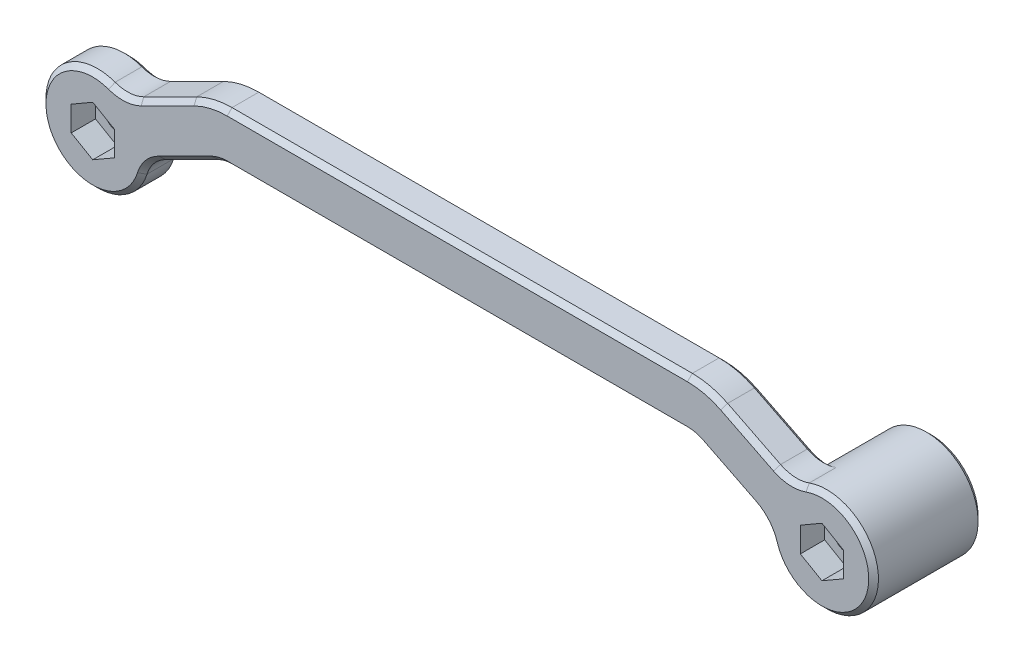
from build123d import *

# Parameters (mm, degrees)
SKETCH1_R                = 2.05
BOSS_EXTRUDE1_DEPTH      = 6
CUT_EXTRUDE1_DEPTH       = 4
BOSS_EXTRUDE2_DEPTH      = 12
BOSS_EXTRUDE2_DEPTH_BACK = 1
SKETCH4_R                = 8.5
SKETCH4_R_2              = 2.05
CHAMFER3_SIZE            = 0.8


with BuildPart() as part:
    # Sketch1 → Boss-Extrude1 (new body)
    with BuildSketch(Plane.XY):
        with BuildLine():
            Line((-52.397368877, 8.273451517), (-43.689164944, 12.627553483))
            ThreePointArc((-43.689164944, 12.627553483), (-40.86217617, 13.652236863), (-37.875388203, 14))
            Line((-37.875388203, 14), (37.875388203, 14))
            ThreePointArc((37.875388203, 14), (40.86217617, 13.652236863), (43.689164944, 12.627553483))
            Line((43.689164944, 12.627553483), (52.397368877, 8.273451517))
            ThreePointArc((52.397368877, 8.273451517), (54.728318318, 7.650368424), (57.116243367, 7.995870664))
            ThreePointArc((57.116243367, 7.995870664), (67.602631123, -3.801315562), (51.873049489, -2.490517092))
            ThreePointArc((51.873049489, -2.490517092), (50.716696252, -0.372875708), (48.819660113, 1.118033989))
            Line((48.819660113, 1.118033989), (40.11145618, 5.472135955))
            ThreePointArc((40.11145618, 5.472135955), (39.024152805, 5.866244947), (37.875388203, 6))
            Line((37.875388203, 6), (-37.875388203, 6))
            ThreePointArc((-37.875388203, 6), (-39.024152805, 5.866244947), (-40.11145618, 5.472135955))
            Line((-40.11145618, 5.472135955), (-48.819660113, 1.118033989))
            ThreePointArc((-48.819660113, 1.118033989), (-50.716696252, -0.372875708), (-51.873049489, -2.490517092))
            ThreePointArc((-51.873049489, -2.490517092), (-67.602631123, -3.801315562), (-57.116243367, 7.995870664))
            ThreePointArc((-57.116243367, 7.995870664), (-54.728318318, 7.650368424), (-52.397368877, 8.273451517))
        make_face()
        with Locations((-60, 0)):
            Circle(SKETCH1_R, mode=Mode.SUBTRACT)
        with Locations((60, 0)):
            Circle(SKETCH1_R, mode=Mode.SUBTRACT)
    extrude(amount=BOSS_EXTRUDE1_DEPTH)

    # Sketch3 → Cut-Extrude1 (cut)
    with BuildSketch(Plane.XY.offset(6)):
        Polygon((-60, 4.099186911), (-63.55, 2.049593456), (-63.55, -2.049593456), (-60, -4.099186911), (-56.45, -2.049593456), (-56.45, 2.049593456), align=None)
        Polygon((60, 4.099186911), (56.45, 2.049593456), (56.45, -2.049593456), (60, -4.099186911), (63.55, -2.049593456), (63.55, 2.049593456), align=None)
    extrude(amount=-CUT_EXTRUDE1_DEPTH, mode=Mode.SUBTRACT)

    # Sketch4 → Boss-Extrude2 (add, two sides: drawn at the far end of the back side and taken through both)
    with BuildSketch(Plane(origin=(0, 0, 0), x_dir=(-1, 0, 0), z_dir=(0, 0, -1)).offset(-BOSS_EXTRUDE2_DEPTH_BACK)):
        with Locations((-60, 0)):
            Circle(SKETCH4_R)
        with Locations((-60, 0)):
            Circle(SKETCH4_R_2, mode=Mode.SUBTRACT)
    extrude(amount=BOSS_EXTRUDE2_DEPTH + BOSS_EXTRUDE2_DEPTH_BACK)

    # Chamfer3
    # the kernel refuses this chamfer: 0.8 mm, written as the material it adds along each edge
    # the kernel refuses this chamfer: 0.8 mm, written as the material it takes off along each edge
    with BuildSketch(Plane(origin=(37.875388203, 1, 0), x_dir=(0.44721359549995965, 0.894427190999915, 0), z_dir=(0.894427190999915, -0.44721359549995965, 0))) as chamfer3_2_piece_1:
        Polygon((5, CHAMFER3_SIZE), (5 + CHAMFER3_SIZE, 0), (5, 0), align=None)
    revolve(axis=Axis((37.875388203, 1, 0), (0, 0, 1)), revolution_arc=26.565051177, mode=Mode.SUBTRACT)
    with BuildSketch(Plane(origin=(48.819660113, 1.118033989, 0), x_dir=(-0.012296529840444168, -0.024593059680888388, 0.9996219169112966), z_dir=(-0.8944271909999163, 0.44721359549995715, 0)), Plane(origin=(-40.11145618, 5.472135955, 0), x_dir=(0.01229652984044405, -0.02459305968088818, 0.9996219169112966), z_dir=(-0.8944271909999165, -0.4472135954999568, 0)), Plane(origin=(43.689164944, 12.627553483, 0), x_dir=(0.012296529840444093, 0.02459305968088816, 0.9996219169112966), z_dir=(0.8944271909999156, -0.44721359549995837, 0)), Plane(origin=(48.819660113, 1.118033989, 6), x_dir=(0.4470445116024604, 0.8940890232049228, 0.02749587661058619), z_dir=(-0.8944271909999163, 0.44721359549995715, 0)), Plane(origin=(-40.11145618, 5.472135955, 6), x_dir=(-0.4470445116024601, 0.8940890232049231, 0.02749587661058619), z_dir=(-0.8944271909999165, -0.4472135954999568, 0)), Plane(origin=(43.689164944, 12.627553483, 6), x_dir=(-0.4470445116024617, -0.8940890232049222, 0.027495876610586216), z_dir=(0.8944271909999156, -0.44721359549995837, 0)), Plane(origin=(-52.397368877, 8.273451517, 6), x_dir=(0.44704451160246106, -0.8940890232049225, 0.027495876610586212), z_dir=(0.894427190999916, 0.4472135954999578, 0))) as chamfer3_2_piece_2:
        Polygon((CHAMFER3_SIZE * 0.999621916911, CHAMFER3_SIZE * 0.0274958766106), (-CHAMFER3_SIZE * 0.0274958766106, CHAMFER3_SIZE * 0.999621916911), (0, 0), align=None)
    extrude(amount=9.736067977, mode=Mode.SUBTRACT)
    with BuildSketch(Plane(origin=(37.875388203, 6, 0), x_dir=(0, -0.027495876610586275, 0.9996219169112968), z_dir=(-1, 0, 0)), Plane(origin=(-37.875388203, 14, 0), x_dir=(0, 0.02749587661058735, 0.9996219169112966), z_dir=(1, 0, 0)), Plane(origin=(37.875388203, 6, 6), x_dir=(0, 0.9996219169112968, 0.027495876610586285), z_dir=(-1, 0, 0)), Plane(origin=(-37.875388203, 14, 6), x_dir=(0, -0.9996219169112968, 0.027495876610586226), z_dir=(1, 0, 0))) as chamfer3_2_piece_3:
        Polygon((CHAMFER3_SIZE * 0.999621916911, CHAMFER3_SIZE * 0.0274958766106), (-CHAMFER3_SIZE * 0.0274958766106, CHAMFER3_SIZE * 0.999621916911), (0, 0), align=None)
    extrude(amount=75.750776405, mode=Mode.SUBTRACT)
    with BuildSketch(Plane(origin=(46.13637854, -4.248529157, 0), x_dir=(0.9989622079668251, -0.04554675678954209, 0), z_dir=(-0.04554675678954209, -0.9989622079668251, 0))) as chamfer3_2_piece_4_section:
        Polygon((6, CHAMFER3_SIZE), (6 + CHAMFER3_SIZE, 0), (6, 0), align=None)
    chamfer3_2_piece_4 = revolve(axis=Axis((46.13637854, -4.248529157, 0), (0, 0, 1)), revolution_arc=66.045488886, mode=Mode.PRIVATE)
    chamfer3_2_piece_4 = chamfer3_2_piece_4 - Plane(origin=(60, 0, 0.316419024), x_dir=(-1, 0, 0), z_dir=(0, 0, 1)) * Cylinder(8.5, 28, mode=Mode.PRIVATE)
    add(chamfer3_2_piece_4, mode=Mode.SUBTRACT)
    with BuildSketch(Plane(origin=(-37.875388203, 1, 0), x_dir=(0, 1, 0), z_dir=(1, 0, 0))) as chamfer3_2_piece_5:
        Polygon((5, CHAMFER3_SIZE), (5 + CHAMFER3_SIZE, 0), (5, 0), align=None)
    revolve(axis=Axis((-37.875388203, 1, 0), (0, 0, 1)), revolution_arc=26.565051177, mode=Mode.SUBTRACT)
    with BuildSketch(Plane(origin=(55.08065045, 13.640014663, 0), x_dir=(-0.44721359549995726, -0.8944271909999163, 0), z_dir=(-0.8944271909999163, 0.44721359549995726, 0))) as chamfer3_2_piece_6_section:
        Polygon((6, CHAMFER3_SIZE), (6 + CHAMFER3_SIZE, 0), (6, 0), align=None)
    chamfer3_2_piece_6 = revolve(axis=Axis((55.08065045, 13.640014663, 0), (0, 0, 1)), revolution_arc=66.045488886, mode=Mode.PRIVATE)
    chamfer3_2_piece_6 = chamfer3_2_piece_6 - Plane(origin=(60, 0, 0.316418933), x_dir=(-1, 0, 0), z_dir=(0, 0, 1)) * Cylinder(8.5, 28, mode=Mode.PRIVATE)
    add(chamfer3_2_piece_6, mode=Mode.SUBTRACT)
    with BuildSketch(Plane(origin=(-46.13637854, -4.248529157, 0), x_dir=(-0.4472135954999641, 0.8944271909999129, 0), z_dir=(0.8944271909999129, 0.4472135954999641, 0))) as chamfer3_2_piece_7:
        Polygon((6, CHAMFER3_SIZE), (6 + CHAMFER3_SIZE, 0), (6, 0), align=None)
    revolve(axis=Axis((-46.13637854, -4.248529157, 0), (0, 0, 1)), revolution_arc=46.397181027, mode=Mode.SUBTRACT)
    with BuildSketch(Plane(origin=(-60, 0, 0), x_dir=(0.9561118248619797, -0.29300201084479827, 0), z_dir=(0.29300201084479827, 0.9561118248619797, 0))) as chamfer3_2_piece_8:
        Polygon((8.5 - CHAMFER3_SIZE, 0), (8.5, -CHAMFER3_SIZE), (8.5, 0), align=None)
    revolve(axis=Axis((-60, 0, 0), (0, 0, -1)), revolution_arc=272.794362055, mode=Mode.SUBTRACT)
    with BuildSketch(Plane(origin=(37.875388203, 1, 0), x_dir=(0, 1, 0), z_dir=(-1, 0, 0))) as chamfer3_2_piece_9:
        Polygon((13, -CHAMFER3_SIZE), (13 - CHAMFER3_SIZE, 0), (13, 0), align=None)
    revolve(axis=Axis((37.875388203, 1, 0), (0, 0, -1)), revolution_arc=26.565051177, mode=Mode.SUBTRACT)
    with BuildSketch(Plane(origin=(-55.08065045, 13.640014663, 0), x_dir=(-0.3392654862413453, -0.940690666396464, 0), z_dir=(-0.940690666396464, 0.3392654862413453, 0))) as chamfer3_2_piece_10:
        Polygon((6, CHAMFER3_SIZE), (6 + CHAMFER3_SIZE, 0), (6, 0), align=None)
    revolve(axis=Axis((-55.08065045, 13.640014663, 0), (0, 0, 1)), revolution_arc=46.397181027, mode=Mode.SUBTRACT)
    with BuildSketch(Plane(origin=(-52.397368877, 8.273451517, 0), x_dir=(0.44704451160246106, -0.8940890232049225, -0.027495876610586303), z_dir=(0.894427190999916, 0.4472135954999578, 0))) as chamfer3_2_piece_11:
        Polygon((CHAMFER3_SIZE * 0.999621916911, -CHAMFER3_SIZE * 0.0274958766106), (-CHAMFER3_SIZE * 0.0274958766106, -CHAMFER3_SIZE * 0.999621916911), (0, 0), align=None)
    extrude(amount=9.736067977, mode=Mode.SUBTRACT)
    with BuildSketch(Plane(origin=(-37.875388203, 1, 0), x_dir=(-0.4472135954999576, 0.894427190999916, 0), z_dir=(-0.894427190999916, -0.4472135954999576, 0))) as chamfer3_2_piece_12:
        Polygon((13, -CHAMFER3_SIZE), (13 - CHAMFER3_SIZE, 0), (13, 0), align=None)
    revolve(axis=Axis((-37.875388203, 1, 0), (0, 0, -1)), revolution_arc=26.565051177, mode=Mode.SUBTRACT)
    with BuildSketch(Plane(origin=(37.875388203, 1, 6), x_dir=(0.44721359549995965, 0.894427190999915, 0), z_dir=(0.894427190999915, -0.44721359549995965, 0))) as chamfer3_2_piece_13:
        Polygon((5 + CHAMFER3_SIZE, 0), (5, -CHAMFER3_SIZE), (5, 0), align=None)
    revolve(axis=Axis((37.875388203, 1, 6), (0, 0, 1)), revolution_arc=26.565051177, mode=Mode.SUBTRACT)
    with BuildSketch(Plane(origin=(46.13637854, -4.248529157, 6), x_dir=(0.956111824861979, 0.2930020108448003, 0), z_dir=(0.2930020108448003, -0.956111824861979, 0))) as chamfer3_2_piece_14:
        Polygon((6 + CHAMFER3_SIZE, 0), (6, -CHAMFER3_SIZE), (6, 0), align=None)
    revolve(axis=Axis((46.13637854, -4.248529157, 6), (0, 0, 1)), revolution_arc=46.397181027, mode=Mode.SUBTRACT)
    with BuildSketch(Plane(origin=(-37.875388203, 1, 6), x_dir=(0, 1, 0), z_dir=(1, 0, 0))) as chamfer3_2_piece_15:
        Polygon((5 + CHAMFER3_SIZE, 0), (5, -CHAMFER3_SIZE), (5, 0), align=None)
    revolve(axis=Axis((-37.875388203, 1, 6), (0, 0, 1)), revolution_arc=26.565051177, mode=Mode.SUBTRACT)
    with BuildSketch(Plane(origin=(60, 0, 6), x_dir=(-0.3392654862413484, 0.9406906663964629, 0), z_dir=(-0.9406906663964629, -0.3392654862413484, 0))) as chamfer3_2_piece_16:
        Polygon((8.5 - CHAMFER3_SIZE, 0), (8.5, CHAMFER3_SIZE), (8.5, 0), align=None)
    revolve(axis=Axis((60, 0, 6), (0, 0, -1)), revolution_arc=272.794362055, mode=Mode.SUBTRACT)
    with BuildSketch(Plane(origin=(55.08065045, 13.640014663, 6), x_dir=(-0.44721359549995726, -0.8944271909999163, 0), z_dir=(-0.8944271909999163, 0.44721359549995726, 0))) as chamfer3_2_piece_17:
        Polygon((6 + CHAMFER3_SIZE, 0), (6, -CHAMFER3_SIZE), (6, 0), align=None)
    revolve(axis=Axis((55.08065045, 13.640014663, 6), (0, 0, 1)), revolution_arc=46.397181027, mode=Mode.SUBTRACT)
    with BuildSketch(Plane(origin=(-46.13637854, -4.248529157, 6), x_dir=(-0.4472135954999641, 0.8944271909999129, 0), z_dir=(0.8944271909999129, 0.4472135954999641, 0))) as chamfer3_2_piece_18:
        Polygon((6 + CHAMFER3_SIZE, 0), (6, -CHAMFER3_SIZE), (6, 0), align=None)
    revolve(axis=Axis((-46.13637854, -4.248529157, 6), (0, 0, 1)), revolution_arc=46.397181027, mode=Mode.SUBTRACT)
    with BuildSketch(Plane(origin=(-60, 0, 6), x_dir=(0.9561118248619797, -0.29300201084479827, 0), z_dir=(0.29300201084479827, 0.9561118248619797, 0))) as chamfer3_2_piece_19:
        Polygon((8.5 - CHAMFER3_SIZE, 0), (8.5, CHAMFER3_SIZE), (8.5, 0), align=None)
    revolve(axis=Axis((-60, 0, 6), (0, 0, -1)), revolution_arc=272.794362055, mode=Mode.SUBTRACT)
    with BuildSketch(Plane(origin=(37.875388203, 1, 6), x_dir=(0, 1, 0), z_dir=(-1, 0, 0))) as chamfer3_2_piece_20:
        Polygon((13 - CHAMFER3_SIZE, 0), (13, CHAMFER3_SIZE), (13, 0), align=None)
    revolve(axis=Axis((37.875388203, 1, 6), (0, 0, -1)), revolution_arc=26.565051177, mode=Mode.SUBTRACT)
    with BuildSketch(Plane(origin=(-55.08065045, 13.640014663, 6), x_dir=(-0.3392654862413453, -0.940690666396464, 0), z_dir=(-0.940690666396464, 0.3392654862413453, 0))) as chamfer3_2_piece_21:
        Polygon((6, -CHAMFER3_SIZE), (6 + CHAMFER3_SIZE, 0), (6, 0), align=None)
    revolve(axis=Axis((-55.08065045, 13.640014663, 6), (0, 0, 1)), revolution_arc=46.397181027, mode=Mode.SUBTRACT)
    with BuildSketch(Plane(origin=(-37.875388203, 1, 6), x_dir=(-0.4472135954999576, 0.894427190999916, 0), z_dir=(-0.894427190999916, -0.4472135954999576, 0))) as chamfer3_2_piece_22:
        Polygon((13 - CHAMFER3_SIZE, 0), (13, CHAMFER3_SIZE), (13, 0), align=None)
    revolve(axis=Axis((-37.875388203, 1, 6), (0, 0, -1)), revolution_arc=26.565051177, mode=Mode.SUBTRACT)
    with BuildSketch(Plane(origin=(60, 0, -12), x_dir=(-1, 0, 0), z_dir=(0, -1, 0))) as chamfer3_2_piece_23:
        Polygon((8.5 - CHAMFER3_SIZE, 0), (8.5, -CHAMFER3_SIZE), (8.5, 0), align=None)
    revolve(axis=Axis((60, 0, -12), (0, 0, -1)), mode=Mode.SUBTRACT)


solid = part.part
